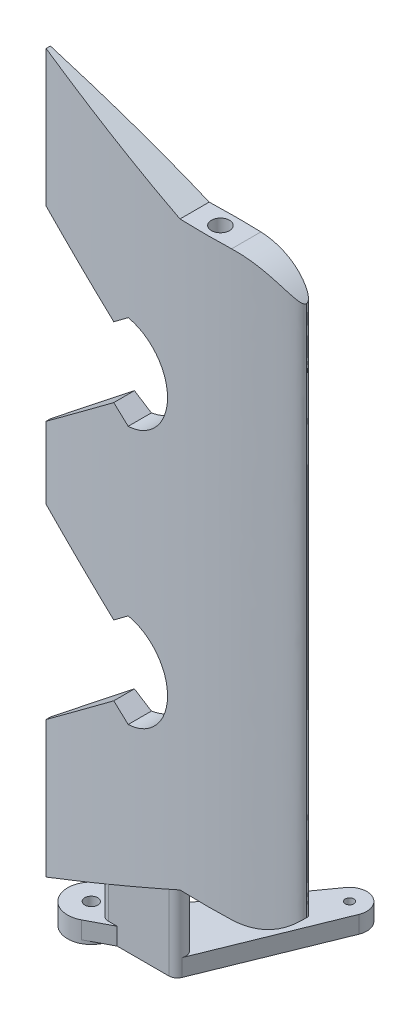
from build123d import *

# Parameters (mm, degrees)
BOSS_EXTRUDE1_DEPTH = 100
CUT_EXTRUDE2_START  = -1.7500001
CUT_EXTRUDE2_DEPTH  = 3.5000002
CUT_EXTRUDE3_DEPTH  = 97.476035866
LPATTERN1_COUNT     = 2
LPATTERN1_PITCH     = 30
SKETCH4_R           = 1.05
CUT_EXTRUDE4_DEPTH  = 82.192325984
BOSS_EXTRUDE2_DEPTH = 8
SKETCH7_R           = 0.5
BOSS_EXTRUDE3_DEPTH = 2
BOSS_EXTRUDE4_DEPTH = 2
BOSS_EXTRUDE5_START = 0.4
SKETCH9_R           = 2.75
BOSS_EXTRUDE5_DEPTH = 0.4
CUT_EXTRUDE5_REACH  = 94.494
SKETCH10_R          = 0.75


# Read off the part's stored shape, not the designer's step: Cut-Extrude2
with BuildPart() as part:
    # Sketch1 → Boss-Extrude1 (new body)
    with BuildSketch(Plane(origin=(0, 0, 0), x_dir=(1, 0, 0), z_dir=(0, 1, 0))):
        with BuildLine():
            Line((-29.998958315, 0.25), (-29.998958315, -0.25))
            add(Edge.make_bspline(
                [(0, 0), (0, -2.016870602), (-12.23523021, -2.532663226), (-29.998958315, -0.25)],
                knots=[0, 0, 0, 0, 1, 1, 1, 1], degree=3))
            add(Edge.make_bspline(
                [(0, 0), (0, 2.016870602), (-12.23523021, 2.532663226), (-29.998958315, 0.25)],
                knots=[0, 0, 0, 0, 1, 1, 1, 1], degree=3))
        make_face()
    extrude(amount=BOSS_EXTRUDE1_DEPTH)

    # Cut-Extrude2 outline → Cut-Extrude2 (cut)
    with BuildSketch(Plane.XY.offset(CUT_EXTRUDE2_START)):
        with BuildLine():
            Line((-13, 16.25), (-29.998958315, 8.323255557))
            Line((-29.998958315, 8.323255557), (-31, 7.856462153))
            Line((-31, 7.856462153), (-31, 0))
            Line((-31, 0), (2, 0))
            Line((2, 0), (2, 21.069022805))
            Line((2, 21.069022805), (0.000107656, 19.108677097))
            ThreePointArc((0.000107656, 19.108677097), (-3.219340602, 16.992213304), (-7, 16.25))
            Line((-7, 16.25), (-13, 16.25))
        make_face()
        with BuildLine():
            Line((-31, 100), (-31, 92.143537847))
            Line((-31, 92.143537847), (-29.998958315, 91.676744443))
            Line((-29.998958315, 91.676744443), (-13, 83.75))
            Line((-13, 83.75), (-7, 83.75))
            ThreePointArc((-7, 83.75), (-3.219340602, 83.007786696), (0.000107656, 80.891322903))
            Line((0.000107656, 80.891322903), (2, 78.930977195))
            Line((2, 78.930977195), (2, 100))
            Line((2, 100), (-31, 100))
        make_face()
    extrude(amount=CUT_EXTRUDE2_DEPTH, mode=Mode.SUBTRACT)

    # Sketch3 → Cut-Extrude3 (cut, symmetric)
    with BuildSketch(Plane.XY):
        with BuildLine():
            Line((-21.19003001, 60.935676821), (-48.385481866, 40.067872662))
            Line((-48.385481866, 40.067872662), (-48.385481866, 89.932127338))
            Line((-48.385481866, 89.932127338), (-21.19003001, 69.064323179))
            Line((-21.19003001, 69.064323179), (-19.366695441, 70.463417002))
            ThreePointArc((-19.366695441, 70.463417002), (-14.5, 65), (-19.366695441, 59.536582998))
            Line((-19.366695441, 59.536582998), (-21.19003001, 60.935676821))
        make_face()
    cut_extrude3 = extrude(amount=CUT_EXTRUDE3_DEPTH, both=True, mode=Mode.SUBTRACT)

    # LPattern1: Cut-Extrude3 ×2
    with Locations(*[(0, -i * LPATTERN1_PITCH, 0) for i in range(1, LPATTERN1_COUNT)]):
        add(cut_extrude3, mode=Mode.SUBTRACT)

    # Sketch4 → Cut-Extrude4 (cut, through all)
    with BuildSketch(Plane(origin=(0, 83.75, 0), x_dir=(1, 0, 0), z_dir=(0, 1, 0))):
        with Locations(Location((-10, 0, 0), (0, 0, 270))):
            Circle(SKETCH4_R)
    extrude(amount=-CUT_EXTRUDE4_DEPTH, mode=Mode.SUBTRACT)

    # Sketch6 → Boss-Extrude2 (add)
    with BuildSketch(Plane(origin=(0, 16.25, 0), x_dir=(1, 0, 0), z_dir=(0, 1, 0))):
        with BuildLine():
            Line((-15, -1), (-22, -1))
            ThreePointArc((-22, -1), (-23, 0), (-22, 1))
            Line((-22, 1), (-15, 1))
            ThreePointArc((-15, 1), (-14, 0), (-15, -1))
        make_face()
    extrude(amount=-BOSS_EXTRUDE2_DEPTH)

    # Sketch7 → Boss-Extrude3 (add)
    with BuildSketch(Plane.XZ.offset(-8.25)):
        with BuildLine():
            Line((-8.146431939, -14.248810646), (-14.07321597, 0.375594677))
            ThreePointArc((-14.07321597, 0.375594677), (-14.441249016, 0.82933548), (-15, 1))
            Line((-15, 1), (-22, 1))
            ThreePointArc((-22, 1), (-22.889718381, 0.456509805), (-22.812330329, -0.583197597))
            Line((-22.812330329, -0.583197597), (-11.624660658, -16.166395193))
            ThreePointArc((-11.624660658, -16.166395193), (-9.034400563, -16.751461597), (-8.146431939, -14.248810646))
        make_face()
        with Locations(Location((-10, -15, 0), (0, 0, 270))):
            Circle(SKETCH7_R, mode=Mode.SUBTRACT)
    extrude(amount=BOSS_EXTRUDE3_DEPTH)

    # Sketch8 → Boss-Extrude4 (add)
    with BuildSketch(Plane.XZ.offset(-6.25)):
        with BuildLine():
            Line((-21, -3.107575099), (-25.23782827, -2.739696646))
            ThreePointArc((-25.23782827, -2.739696646), (-27.638391537, 0.775493455), (-23.717537732, 2.432650926))
            Line((-23.717537732, 2.432650926), (-21, 1))
            Line((-21, 1), (-21, -3.107575099))
        make_face()
    extrude(amount=-BOSS_EXTRUDE4_DEPTH)

    # Sketch9 → Boss-Extrude5 (add)
    with BuildSketch(Plane.XZ.offset(-6.25).offset(BOSS_EXTRUDE5_START)):
        with Locations(Location((-25, 0, 0), (0, 0, 270))):
            Circle(SKETCH9_R)
    extrude(amount=-BOSS_EXTRUDE5_DEPTH)

    # Sketch10 → Cut-Extrude5 (cut, up to next)
    with BuildSketch(Plane.XZ.offset(-5.85), mode=Mode.PRIVATE) as cut_extrude5_sk1:
        with Locations(Location((-25, 0, 0), (0, 0, 270))):
            Circle(SKETCH10_R)
    cut_extrude5_tool1 = extrude(cut_extrude5_sk1.sketch, amount=-CUT_EXTRUDE5_REACH, mode=Mode.PRIVATE) & part.part
    add(cut_extrude5_tool1.solids().sort_by_distance((-25, 5.85, 0))[0], mode=Mode.SUBTRACT)


solid = part.part
